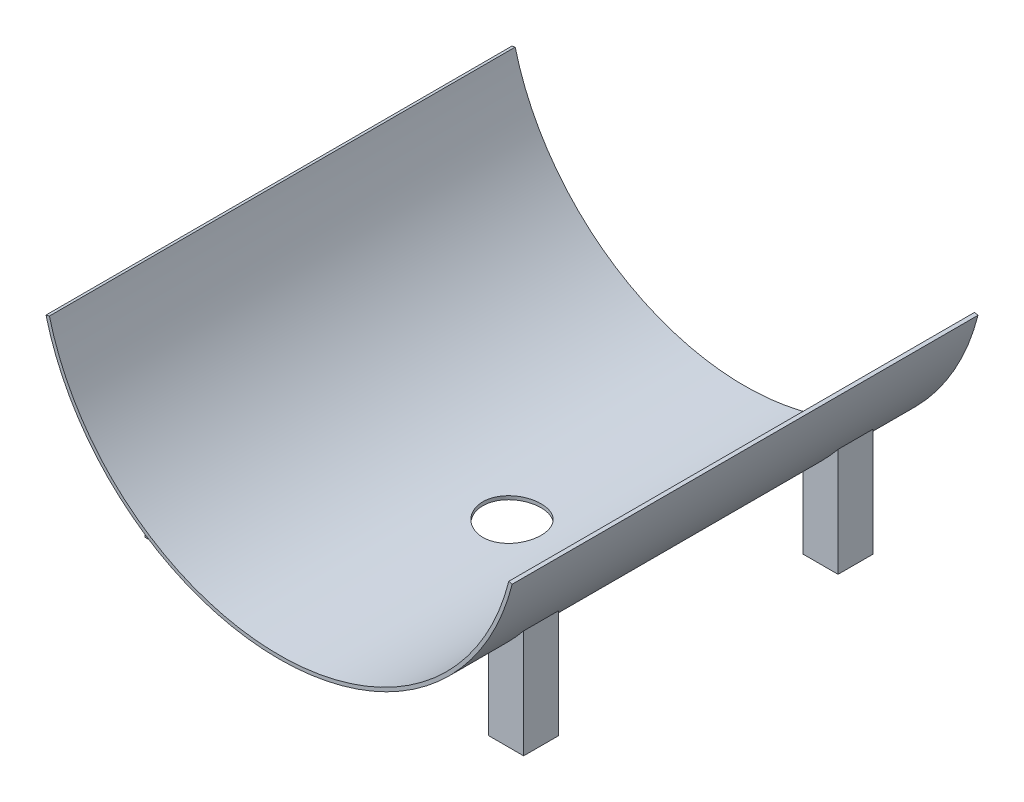
from build123d import *

# Parameters (mm, degrees)
EXTRUDE_THIN1_DEPTH      = 400
BOSS_EXTRUDE1_REACH      = 481.761
BOSS_EXTRUDE1_END_RADIUS = 206.5
SKETCH2_W                = 30
SKETCH2_H                = 30
SKETCH3_R                = 25
CUT_EXTRUDE1_DEPTH       = 480.760613857


with BuildPart() as part:
    # Sketch1 → Extrude-Thin1 (new body)
    with BuildSketch(Plane.XY):
        with BuildLine():
            ThreePointArc((-197.261881771, 173.5), (0, 20), (197.261881771, 173.5))
            Line((197.261881771, 173.5), (200.169919341, 172.762899263))
            ThreePointArc((200.169919341, 172.762899263), (0, 17), (-200.169919341, 172.762899263))
            Line((-200.169919341, 172.762899263), (-197.261881771, 173.5))
        make_face()
    extrude(amount=EXTRUDE_THIN1_DEPTH)

    # Boss-Extrude1: up to this cylinder (the profile starts outside it)
    boss_extrude1_end = Plane(origin=(0, 223.5, 200), z_dir=(0, 0, -1)) * Cylinder(BOSS_EXTRUDE1_END_RADIUS, 1647.522, mode=Mode.PRIVATE)
    # Sketch2 → Boss-Extrude1 (add, up to the surface)
    with BuildSketch(Plane(origin=(0, 0, 0), x_dir=(1, 0, 0), z_dir=(0, 1, 0)), mode=Mode.PRIVATE) as boss_extrude1_sk1:
        with Locations((-150, -335)):
            Rectangle(SKETCH2_W, SKETCH2_H)
    boss_extrude1_tool1 = extrude(boss_extrude1_sk1.sketch, amount=BOSS_EXTRUDE1_REACH, mode=Mode.PRIVATE) - boss_extrude1_end
    add(boss_extrude1_tool1.solids().sort_by_distance((-150, 0, 335))[0])
    # Sketch2 → Boss-Extrude1 (add, up to the surface)
    with BuildSketch(Plane(origin=(0, 0, 0), x_dir=(1, 0, 0), z_dir=(0, 1, 0)), mode=Mode.PRIVATE) as boss_extrude1_sk2:
        with Locations((145, -335)):
            Rectangle(SKETCH2_W, SKETCH2_H)
    boss_extrude1_tool2 = extrude(boss_extrude1_sk2.sketch, amount=BOSS_EXTRUDE1_REACH, mode=Mode.PRIVATE) - boss_extrude1_end
    add(boss_extrude1_tool2.solids().sort_by_distance((145, 0, 335))[0])
    # Sketch2 → Boss-Extrude1 (add, up to the surface)
    with BuildSketch(Plane(origin=(0, 0, 0), x_dir=(1, 0, 0), z_dir=(0, 1, 0)), mode=Mode.PRIVATE) as boss_extrude1_sk3:
        with Locations((-150, -65)):
            Rectangle(SKETCH2_W, SKETCH2_H)
    boss_extrude1_tool3 = extrude(boss_extrude1_sk3.sketch, amount=BOSS_EXTRUDE1_REACH, mode=Mode.PRIVATE) - boss_extrude1_end
    add(boss_extrude1_tool3.solids().sort_by_distance((-150, 0, 65))[0])
    # Sketch2 → Boss-Extrude1 (add, up to the surface)
    with BuildSketch(Plane(origin=(0, 0, 0), x_dir=(1, 0, 0), z_dir=(0, 1, 0)), mode=Mode.PRIVATE) as boss_extrude1_sk4:
        with Locations((145, -65)):
            Rectangle(SKETCH2_W, SKETCH2_H)
    boss_extrude1_tool4 = extrude(boss_extrude1_sk4.sketch, amount=BOSS_EXTRUDE1_REACH, mode=Mode.PRIVATE) - boss_extrude1_end
    add(boss_extrude1_tool4.solids().sort_by_distance((145, 0, 65))[0])

    # Sketch3 → Cut-Extrude1 (cut, through all)
    with BuildSketch(Plane(origin=(0, 0, 0), x_dir=(1, 0, 0), z_dir=(0, 1, 0))):
        with Locations((0, -200)):
            Circle(SKETCH3_R)
    extrude(amount=CUT_EXTRUDE1_DEPTH, mode=Mode.SUBTRACT)


solid = part.part
